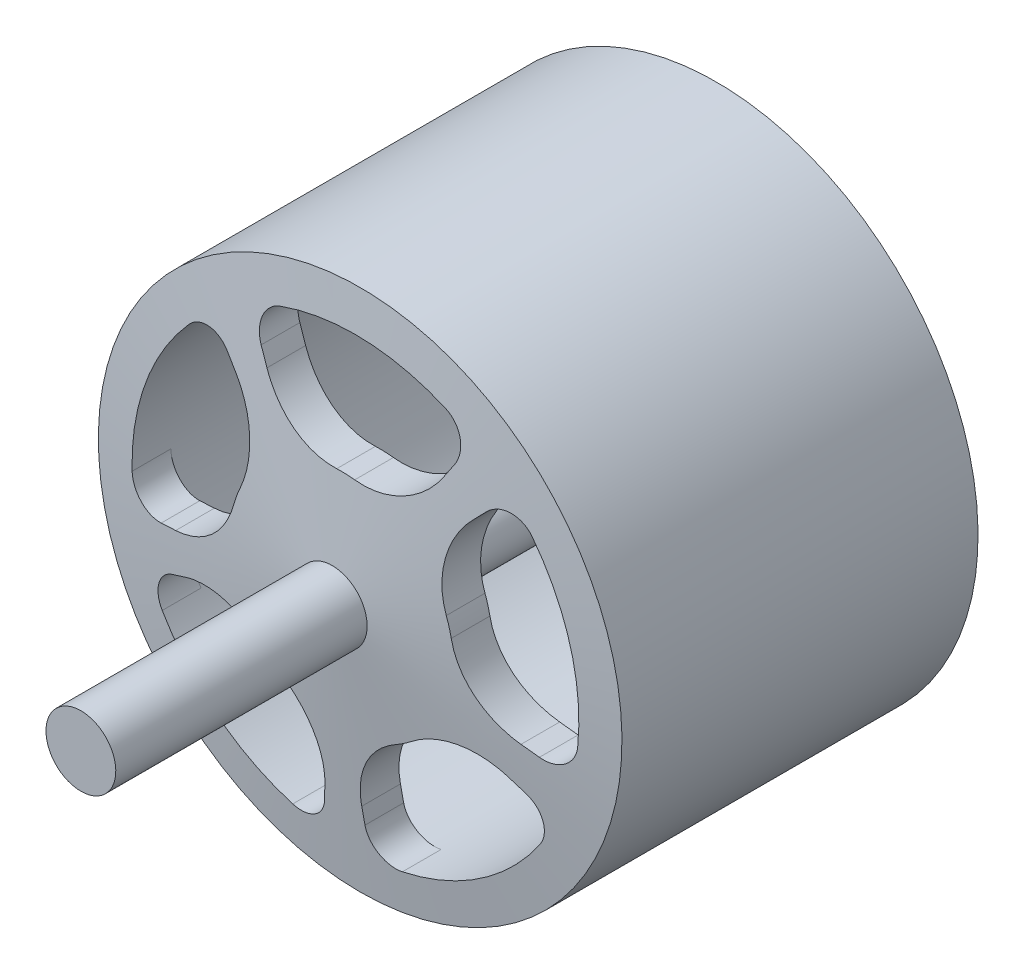
from build123d import *

# Parameters (mm, degrees)
CUT_EXTRUDE1_DEPTH = 53.662842688
CIRPATTERN1_COUNT  = 5


with BuildPart() as part:
    # Sketch1 → Revolve1 (revolve)
    with BuildSketch(Plane(origin=(0, 0, 0), x_dir=(0, 0, -1), z_dir=(1, 0, 0))):
        Polygon((-45.5, 0), (-45.5, 2.5), (-27.5, 2.5), (-25.5, 18.75), (0, 18.75), (0, 16), (-23.067711421, 16), (-24.729249883, 2.5), (7.7, 2.5), (7.7, 0), (0, 0), align=None)
    revolve(axis=Axis((0, 0, 45.5), (0, 0, -1)))

    # Sketch2 → Cut-Extrude1 (cut, through all)
    with BuildSketch(Plane.XY):
        with BuildLine():
            Line((-6.488637759, 12.243266722), (-5.92328878, 11.176522269))
            ThreePointArc((-5.92328878, 11.176522269), (-3.600547795, 8.777820958), (-0.355313587, 7.992105621))
            ThreePointArc((-0.355313587, 7.992105621), (0.290007789, 7.99474174), (0.933442091, 7.945356245))
            ThreePointArc((0.933442091, 7.945356245), (4.227075409, 8.493875363), (6.717507821, 10.717979692))
            Line((6.717507821, 10.717979692), (7.358661127, 11.740958497))
            ThreePointArc((7.358661127, 11.740958497), (7.576311791, 13.38880522), (6.47314256, 14.632102562))
            ThreePointArc((6.47314256, 14.632102562), (0.580015579, 15.989483479), (-5.395970771, 15.06265247))
            ThreePointArc((-5.395970771, 15.06265247), (-6.58632281, 13.90255219), (-6.488637759, 12.243266722))
        make_face()
    cut_extrude1 = extrude(amount=CUT_EXTRUDE1_DEPTH, mode=Mode.SUBTRACT)

    # CirPattern1: Cut-Extrude1 ×5 about axis
    cirpattern1_axis = Axis((0, 0, 45.5), (0, 0, 1))
    for i in range(1, CIRPATTERN1_COUNT):
        add(cut_extrude1.rotate(cirpattern1_axis, i * 360 / CIRPATTERN1_COUNT), mode=Mode.SUBTRACT)


solid = part.part
